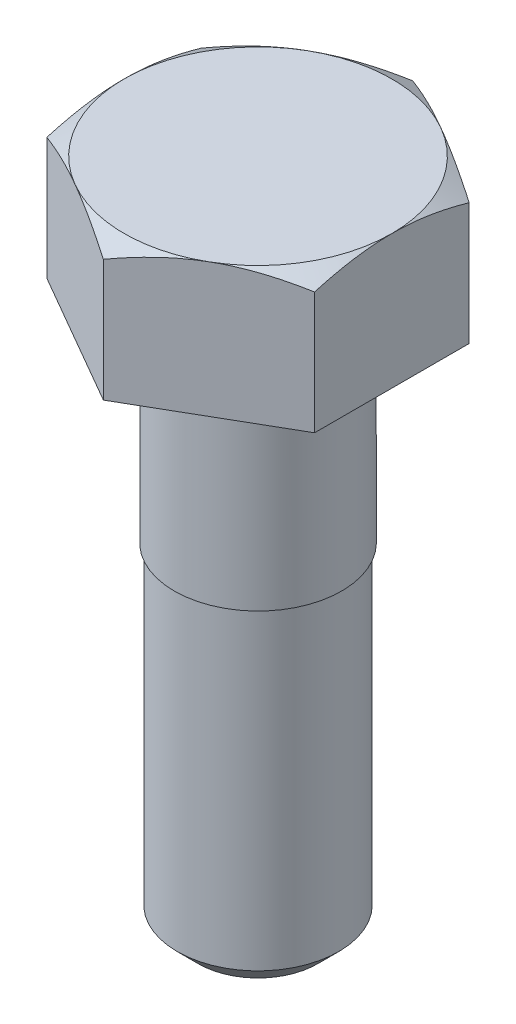
from build123d import *

# Parameters (mm, degrees)
EXTRUDE_1_DEPTH     = 4
SKETCH_2_R          = 2.5
EXTRUDE_2_DEPTH     = 16
SKETCH_3_OUTSIDE_W  = 70.114
SKETCH_3_OUTSIDE_H  = 71.352
SKETCH_3_OUTSIDE_R  = 4
CUT_EXTRUDE_1_DEPTH = 16
CUT_EXTRUDE_1_DRAFT = -60


# Read off the part's stored shape, not the designer's step: #10-24 机械螺纹 螺柱4
with BuildPart() as part:
    # 草图1 → 凸台-拉伸1 (new body)
    with BuildSketch(Plane(origin=(0, 0, 0), x_dir=(1, 0, 0), z_dir=(0, 1, 0))):
        Polygon((4, -2.309401077), (4, 2.309401077), (0, 4.618802154), (-4, 2.309401077), (-4, -2.309401077), (0, -4.618802154), align=None)
    extrude(amount=EXTRUDE_1_DEPTH)

    # 草图2 → 凸台-拉伸2 (add)
    with BuildSketch(Plane.XZ):
        with Locations(Location((0, 0, 0), (0, 0, 270))):
            Circle(SKETCH_2_R)
    extrude(amount=EXTRUDE_2_DEPTH)


with BuildPart() as cut_extrude_1_tool:
    # 草图3 outside → 切除-拉伸1 (with draft: the straight prism first)
    with BuildSketch(Plane(origin=(0, 4, 0), x_dir=(1, 0, 0), z_dir=(0, 1, 0))):
        Rectangle(SKETCH_3_OUTSIDE_W, SKETCH_3_OUTSIDE_H)
        Circle(SKETCH_3_OUTSIDE_R, mode=Mode.SUBTRACT)
    extrude(amount=-CUT_EXTRUDE_1_DEPTH)
    # 切除-拉伸1: the draft: its side faces are tilted about the plane it starts from
    cut_extrude_1_sides = [cut_extrude_1_tool.faces().sort_by_distance(p)[0] for p in [
        (0, -4, 35.676),
        (35.057, -4, 0),
        (0, -4, -35.676),
        (-35.057, -4, 0),
        (-4, -4, 0),
    ]]
    draft(cut_extrude_1_sides, Plane(origin=(0, 4, 0), x_dir=(1, 0, 0), z_dir=(0, 1, 0)), CUT_EXTRUDE_1_DRAFT)


with BuildPart() as part_1:
    add(part.part)

    # 切除-拉伸1: cut by cut_extrude_1_tool
    add(cut_extrude_1_tool.part, mode=Mode.SUBTRACT)

    # #10-24 机械螺纹 螺柱4 outline → #10-24 机械螺纹 螺柱4 (revolve, cut)
    with BuildSketch(Plane.XY):
        Polygon((1.78308, -16), (2.5, -16), (2.5, -6), (2.413, -6), (2.413, -15.37008), align=None)
    revolve(axis=Axis((0, 0, 0), (0, 1, 0)), mode=Mode.SUBTRACT)


solid = part_1.part
